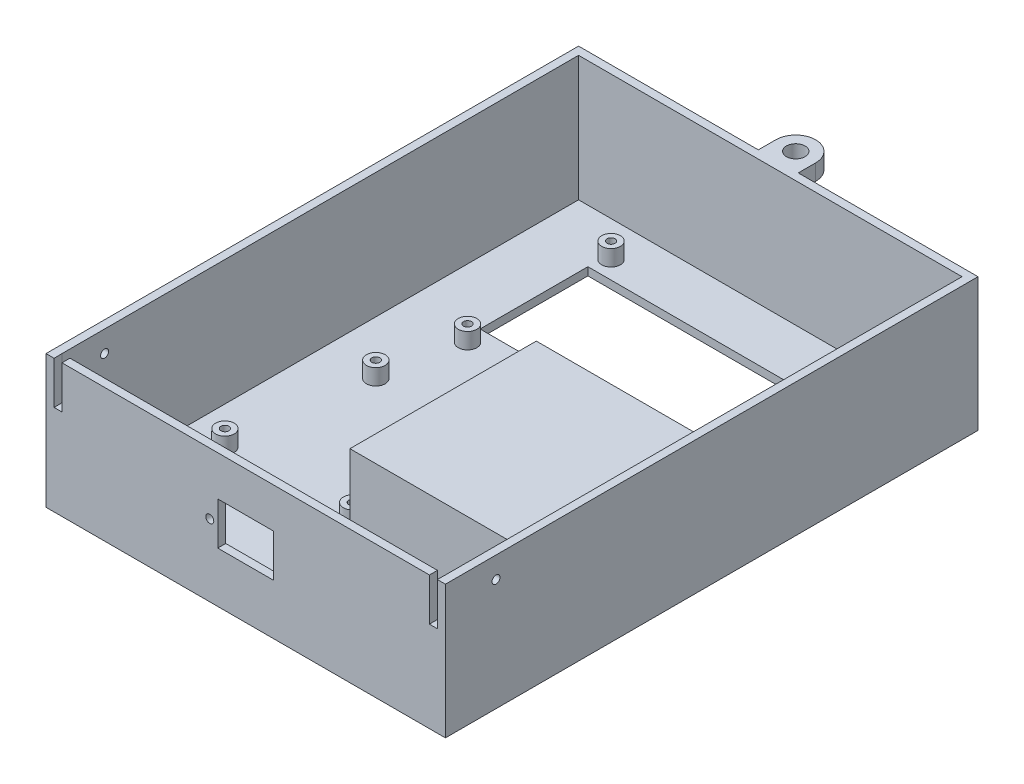
from build123d import *

# Parameters (mm, degrees)
SKETCH1_W               = 150
SKETCH1_H               = 200
BOSS_EXTRUDE1_DEPTH     = 50
SHELL1_T                = -3
SKETCH2_W               = 97
SKETCH2_H               = 40.5
CUT_EXTRUDE1_DEPTH      = 40
SKETCH4_R               = 3.5
BOSS_EXTRUDE2_DEPTH     = 6
SKETCH5_R               = 1.5
CUT_EXTRUDE2_DEPTH      = 6
CUT_EXTRUDE3_DEPTH      = 16
CUT_EXTRUDE4_DEPTH      = 185.686220385
CUT_EXTRUDE4_DEPTH_BACK = 185.686220385
SKETCH9_R               = 1.5
SKETCH11_R              = 1.5
SKETCH11_W              = 21
SKETCH11_H              = 16
CUT_EXTRUDE5_DEPTH      = 217.642562762
SKETCH13_R              = 3.5
BOSS_EXTRUDE5_DEPTH     = 6
FILLET1_R               = 7
SKETCH15_R              = 3.5
SKETCH15_R_2            = 1.5
BOSS_EXTRUDE6_DEPTH     = 6
SKETCH17_W              = 66
SKETCH17_H              = 70
BOSS_EXTRUDE7_DEPTH     = 40
SKETCH18_W              = 60
SKETCH18_H              = 34
CUT_EXTRUDE6_DEPTH      = 67
SKETCH19_W              = 30
SKETCH19_H              = 34
CUT_EXTRUDE7_DEPTH      = 3
CHAMFER1_SIZE           = 15
FILLET2_START           = 6
FILLET2_DEPTH           = 3


with BuildPart() as part:
    # Sketch1 → Boss-Extrude1 (new body)
    with BuildSketch(Plane(origin=(0, 0, 0), x_dir=(1, 0, 0), z_dir=(0, 1, 0))):
        Rectangle(SKETCH1_W, SKETCH1_H)
    extrude(amount=BOSS_EXTRUDE1_DEPTH)

    # Shell1
    shell1_openings = [part.faces().sort_by_distance(p)[0] for p in [
        (0, 50, 0),
    ]]
    offset(amount=SHELL1_T, openings=shell1_openings, kind=Kind.INTERSECTION)

    # Sketch2 → Cut-Extrude1 (cut)
    with BuildSketch(Plane(origin=(0, 3, 0), x_dir=(1, 0, 0), z_dir=(0, 1, 0))):
        with Locations((0, 56.75)):
            Rectangle(SKETCH2_W, SKETCH2_H)
    extrude(amount=-CUT_EXTRUDE1_DEPTH, mode=Mode.SUBTRACT)

    # Sketch4 → Boss-Extrude2 (add)
    with BuildSketch(Plane(origin=(0, 3, 0), x_dir=(1, 0, 0), z_dir=(0, 1, 0))):
        with Locations(Location((46.5, 83.7, 0), (0, 0, 90))):
            Circle(SKETCH4_R)
        with Locations(Location((-46.5, 83.7, 0), (0, 0, 90))):
            Circle(SKETCH4_R)
        with Locations(Location((46.5, 29.8, 0), (0, 0, 90))):
            Circle(SKETCH4_R)
        with Locations(Location((-46.5, 29.8, 0), (0, 0, 90))):
            Circle(SKETCH4_R)
    extrude(amount=BOSS_EXTRUDE2_DEPTH)

    # Sketch5 → Cut-Extrude2 (cut)
    with BuildSketch(Plane(origin=(0, 9, 0), x_dir=(1, 0, 0), z_dir=(0, 1, 0))):
        with Locations(Location((-46.5, 83.7, 0), (0, 0, 270))):
            Circle(SKETCH5_R)
        with Locations(Location((46.5, 83.7, 0), (0, 0, 270))):
            Circle(SKETCH5_R)
        with Locations(Location((-46.5, 29.8, 0), (0, 0, 270))):
            Circle(SKETCH5_R)
        with Locations(Location((46.5, 29.8, 0), (0, 0, 270))):
            Circle(SKETCH5_R)
    extrude(amount=-CUT_EXTRUDE2_DEPTH, mode=Mode.SUBTRACT)

    # Sketch7 → Cut-Extrude3 (cut)
    with BuildSketch(Plane(origin=(0, 50, 0), x_dir=(1, 0, 0), z_dir=(0, 1, 0))):
        Polygon((-72, -97), (-72, -80.924133637), (-69, -80.924133637), (-69, -231.933334159), align=None)
        Polygon((69, -231.933334159), (72, -97), (72, -80.924133637), (69, -80.924133637), align=None)
    extrude(amount=-CUT_EXTRUDE3_DEPTH, mode=Mode.SUBTRACT)

    # Sketch9 → Cut-Extrude4 (cut, two sides: drawn at the far end of the back side and taken through both)
    with BuildSketch(Plane(origin=(-72, 0, 0), x_dir=(0, 0, -1), z_dir=(1, 0, 0)).offset(-CUT_EXTRUDE4_DEPTH_BACK)):
        with Locations((-81, 42)):
            Circle(SKETCH9_R)
    extrude(amount=CUT_EXTRUDE4_DEPTH + CUT_EXTRUDE4_DEPTH_BACK, mode=Mode.SUBTRACT)

    # Sketch11 → Cut-Extrude5 (cut, through all)
    with BuildSketch(Plane(origin=(0, 0, 97), x_dir=(-1, 0, 0), z_dir=(0, 0, -1))):
        with Locations((13.5, 26.985710618)):
            Circle(SKETCH11_R)
        with Locations((0, 26.985710618)):
            Rectangle(SKETCH11_W, SKETCH11_H)
    extrude(amount=-CUT_EXTRUDE5_DEPTH, mode=Mode.SUBTRACT)

    # Sketch13 → Boss-Extrude5 (add)
    with BuildSketch(Plane(origin=(0, 50, 0), x_dir=(1, 0, 0), z_dir=(0, 1, 0))):
        with BuildLine():
            Line((-7.5, 106.556339799), (-7.5, 97))
            Line((-7.5, 97), (7.5, 97))
            Line((7.5, 97), (7.5, 106.556339799))
            ThreePointArc((7.5, 106.556339799), (0, 114.056339799), (-7.5, 106.556339799))
        make_face()
        with Locations(Location((0, 106.556339799, 0), (0, 0, 270))):
            Circle(SKETCH13_R, mode=Mode.SUBTRACT)
    extrude(amount=-BOSS_EXTRUDE5_DEPTH)

    # Fillet1
    fillet1_edges = [part.edges().sort_by_distance(p)[0] for p in [
        (0, 3, 97),
    ]]
    fillet(fillet1_edges, radius=FILLET1_R)

    # Sketch15 → Boss-Extrude6 (add)
    # profile 1 of 4: a face of its own
    with BuildSketch(Plane(origin=(0, 3, 0), x_dir=(1, 0, 0), z_dir=(0, 1, 0))):
        with Locations(Location((-58.019508849, -49.793289196, 0), (0, 0, 90))):
            Circle(SKETCH15_R)
        with Locations(Location((-58.019508849, -49.793289196, 0), (0, 0, 270))):
            Circle(SKETCH15_R_2, mode=Mode.SUBTRACT)
    # profile 2 of 4: a face of its own
    with BuildSketch(Plane(origin=(0, 3, 0), x_dir=(1, 0, 0), z_dir=(0, 1, 0))):
        with Locations(Location((-10.019508849, -49.793289196, 0), (0, 0, 90))):
            Circle(SKETCH15_R)
        with Locations(Location((-10.019508849, -49.793289196, 0), (0, 0, 270))):
            Circle(SKETCH15_R_2, mode=Mode.SUBTRACT)
    # profile 3 of 4: a face of its own
    with BuildSketch(Plane(origin=(0, 3, 0), x_dir=(1, 0, 0), z_dir=(0, 1, 0))):
        with Locations(Location((-23.970029682, 0.819287981, 0), (0, 0, 90))):
            Circle(SKETCH15_R)
        with Locations(Location((-23.970029682, 0.819287981, 0), (0, 0, 270))):
            Circle(SKETCH15_R_2, mode=Mode.SUBTRACT)
    # profile 4 of 4: a face of its own
    with BuildSketch(Plane(origin=(0, 3, 0), x_dir=(1, 0, 0), z_dir=(0, 1, 0))):
        with Locations(Location((-51.970029682, 0.819287981, 0), (0, 0, 90))):
            Circle(SKETCH15_R)
        with Locations(Location((-51.970029682, 0.819287981, 0), (0, 0, 270))):
            Circle(SKETCH15_R_2, mode=Mode.SUBTRACT)
    extrude(amount=BOSS_EXTRUDE6_DEPTH)

    # Sketch17 → Boss-Extrude7 (add)
    with BuildSketch(Plane(origin=(0, 3, 0), x_dir=(1, 0, 0), z_dir=(0, 1, 0))):
        with Locations((39, -31.868850241)):
            Rectangle(SKETCH17_W, SKETCH17_H)
    extrude(amount=BOSS_EXTRUDE7_DEPTH)

    # Sketch18 → Cut-Extrude6 (cut)
    with BuildSketch(Plane(origin=(0, 0, -3.131149759), x_dir=(-1, 0, 0), z_dir=(0, 0, -1))):
        with Locations((-39, 23)):
            Rectangle(SKETCH18_W, SKETCH18_H)
    extrude(amount=-CUT_EXTRUDE6_DEPTH, mode=Mode.SUBTRACT)

    # Sketch19 → Cut-Extrude7 (cut)
    with BuildSketch(Plane.ZY.offset(-6)):
        with Locations((44.62857151, 23)):
            Rectangle(SKETCH19_W, SKETCH19_H)
    extrude(amount=-CUT_EXTRUDE7_DEPTH, mode=Mode.SUBTRACT)

    # Chamfer1
    chamfer1_edges = [part.edges().sort_by_distance(p)[0] for p in [
        (7.5, 40, 59.62857151),
        (7.5, 40, 29.62857151),
    ]]
    chamfer(chamfer1_edges, length=CHAMFER1_SIZE - 0.0001)  # a hair under: the kernel refuses the full size


with BuildPart() as fillet2_tool:
    # Fillet2: read off the stored shape, not the designer's step
    # Fillet2 outline → Fillet2 (new body)
    with BuildSketch(Plane.YZ.offset(FILLET2_START)):
        with BuildLine():
            Line((38, 46.62857151), (39.292893219, 45.335678291))
            ThreePointArc((39.292893219, 45.335678291), (39.585786438, 44.628571509), (39.292893219, 43.921464728))
            Line((39.292893219, 43.921464728), (38, 42.628571509))
            Line((38, 42.628571509), (38, 42))
            Line((38, 42), (41, 42))
            Line((41, 42), (41, 47))
            Line((41, 47), (38, 47))
            Line((38, 47), (38, 46.62857151))
        make_face()
    extrude(amount=FILLET2_DEPTH)


with BuildPart() as part_1:
    add(part.part)


with BuildPart() as part_2:
    # Fillet2: joined with fillet2_tool
    add(part_1.part.fuse(fillet2_tool.part, tol=0.00001))


solid = part_2.part
